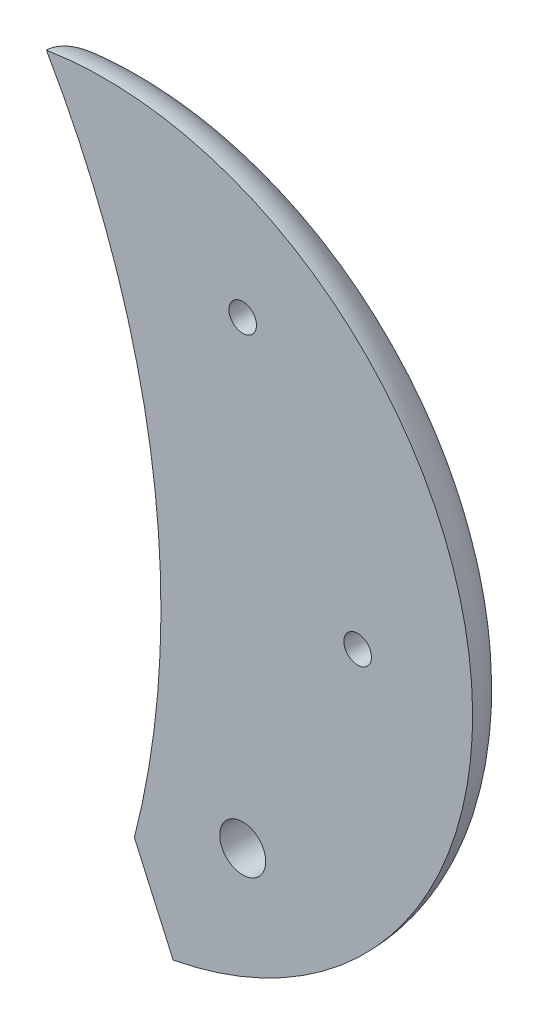
from build123d import *

# Parameters (mm, degrees)
BOSS_EXTRUDE1_DEPTH = 5
SKETCH2_R           = 2.5
SKETCH2_R_2         = 1.5
CUT_EXTRUDE1_DEPTH  = 10
FILLET2_R           = 5


# Some blends are built 0.0001 mm under size
with BuildPart() as part:
    # Sketch1 → Boss-Extrude1 (new body)
    with BuildSketch(Plane.XY):
        with BuildLine():
            ThreePointArc((0, -40), (28.284271247, -28.284271247), (40, 0))
            ThreePointArc((40, 0), (25.942500138, 30.446456059), (-6.349334329, 39.492859526))
            ThreePointArc((-6.349334329, 39.492859526), (5.815471714, 0.464499257), (0, -40))
        make_face()
    extrude(amount=BOSS_EXTRUDE1_DEPTH)

    # Sketch2 → Cut-Extrude1 (cut)
    with BuildSketch(Plane.XY.offset(5)):
        with Locations((15, -25)):
            Circle(SKETCH2_R)
        with Locations((27.5, 0)):
            Circle(SKETCH2_R_2)
        with Locations((15, 25)):
            Circle(SKETCH2_R_2)
    extrude(amount=-CUT_EXTRUDE1_DEPTH, mode=Mode.SUBTRACT)

    # Chamfer1
    # the kernel refuses this chamfer: 10, 7.744855577 mm, written as the material it takes off along each edge
    with BuildSketch(Plane(origin=(0, -40, -27.321942893), x_dir=(0.9956355834600147, 0.09332622861894702, 0), z_dir=(0, 0, 1))) as chamfer1_piece_1:
        with BuildLine():
            Line((7.46609829, 0), (4.150714585, 9.782810082))
            ThreePointArc((4.150714585, 9.782810082), (2.27411481, 4.969757663), (0, 0))
            ThreePointArc((0, 0), (3.797218814, -0.17452519), (7.46609829, 0))
        make_face()
    extrude(amount=59.643885786, mode=Mode.SUBTRACT)

    # Fillet2
    fillet2_edges = [part.edges().sort_by_distance(p)[0] for p in [
        (5.326559747, -34.587866421, 0),
        (5.24041299, 5.748958646, 0),
        (39.401767574, 6.892076033, 0),
    ]]
    fillet(fillet2_edges, radius=FILLET2_R - 0.0001)  # a hair under: the kernel refuses the full size


solid = part.part
